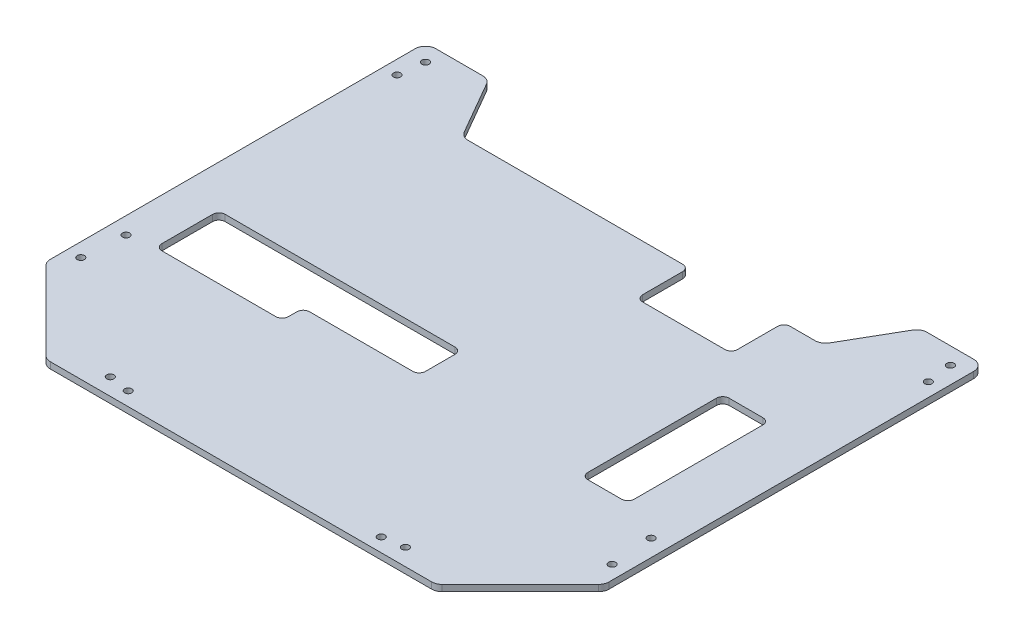
from build123d import *

# Parameters (mm, degrees)
BOSS_EXTRU_1_DEPTH      = 3
CONG_1_R                = 5
ESQUISSE2_R             = 1
ESQUISSE2_R_2           = 1.5
ENL_V_MAT_EXTRU_1_DEPTH = 257.837010573
D_GAGEMENT_M31_D        = 3.4
ESQUISSE5_W             = 45
ESQUISSE5_H             = 25
ESQUISSE5_W_2           = 22
ESQUISSE5_H_2           = 67
ENL_V_MAT_EXTRU_2_DEPTH = 257.837010573
CONG_2_R                = 3


with BuildPart() as part:
    # Esquisse1 → Boss.-Extru.1 (new body)
    with BuildSketch(Plane(origin=(0, 0, 0), x_dir=(1, 0, 0), z_dir=(0, 1, 0))):
        Polygon((-92.5, 0), (92.5, 0), (132.5, 40), (132.5, 220), (102.5, 220), (85.179491924, 190), (-85.179491924, 190), (-102.5, 220), (-132.5, 220), (-132.5, 40), align=None)
    extrude(amount=BOSS_EXTRU_1_DEPTH)

    # Congé1
    cong_1_edges = [part.edges().sort_by_distance(p)[0] for p in [
        (132.5, 1.5, -220),
        (102.5, 1.5, -220),
        (85.179491924, 1.5, -190),
        (-85.179491924, 1.5, -190),
        (-102.5, 1.5, -220),
        (-132.5, 1.5, -220),
        (-132.5, 1.5, -40),
        (-92.5, 1.5, 0),
        (92.5, 1.5, 0),
        (132.5, 1.5, -40),
    ]]
    fillet(cong_1_edges, radius=CONG_1_R)

    # Esquisse2 → Enlèv. mat.-Extru.1 (cut, through all)
    with BuildSketch(Plane.XZ):
        with Locations((-70, -8)):
            Circle(ESQUISSE2_R)
        with Locations((-124.5, -70)):
            Circle(ESQUISSE2_R)
        with Locations((-124.5, -212)):
            Circle(ESQUISSE2_R)
        with Locations((124.5, -212)):
            Circle(ESQUISSE2_R)
        with Locations((124.5, -70)):
            Circle(ESQUISSE2_R)
        with Locations((70, -8)):
            Circle(ESQUISSE2_R)
        with Locations((126, -50)):
            Circle(ESQUISSE2_R_2)
        with Locations((126, -200)):
            Circle(ESQUISSE2_R_2)
        with Locations((-60, -6.5)):
            Circle(ESQUISSE2_R_2)
        with Locations((60, -6.5)):
            Circle(ESQUISSE2_R_2)
        with Locations((-126, -50)):
            Circle(ESQUISSE2_R_2)
        with Locations((-126, -200)):
            Circle(ESQUISSE2_R_2)
    extrude(amount=-ENL_V_MAT_EXTRU_1_DEPTH, mode=Mode.SUBTRACT)

    # Dégagement M31 (through all)
    with Locations(Plane(origin=(0, 0, 0), x_dir=(-1, 0, 0), z_dir=(0, -1, 0))):
        with Locations((-70, 8), (-124.5, 70), (-124.5, 212), (124.5, 212), (124.5, 70), (70, 8), (-126, 200), (-126, 50), (-60, 6.5), (60, 6.5), (126, 50), (126, 200)):
            Hole(D_GAGEMENT_M31_D / 2)

    # Esquisse5 → Enlèv. mat.-Extru.2 (cut, through all)
    with BuildSketch(Plane.XZ):
        with Locations((45, -177.5)):
            Rectangle(ESQUISSE5_W, ESQUISSE5_H)
        Polygon((-112.5, -82), (-112.5, -72), (-52.5, -72), (-52.5, -82), (2.5, -82), (2.5, -102), (-112.5, -102), align=None)
        with Locations((93.5, -112.5)):
            Rectangle(ESQUISSE5_W_2, ESQUISSE5_H_2)
    extrude(amount=-ENL_V_MAT_EXTRU_2_DEPTH, mode=Mode.SUBTRACT)

    # Congé2
    cong_2_edges = [part.edges().sort_by_distance(p)[0] for p in [
        (67.5, 1.5, -190),
        (67.5, 1.5, -165),
        (22.5, 1.5, -165),
        (22.5, 1.5, -190),
        (104.5, 1.5, -146),
        (82.5, 1.5, -146),
        (82.5, 1.5, -79),
        (104.5, 1.5, -79),
        (2.5, 1.5, -82),
        (2.5, 1.5, -102),
        (-112.5, 1.5, -102),
        (-52.5, 1.5, -72),
        (-52.5, 1.5, -82),
        (-112.5, 1.5, -72),
    ]]
    fillet(cong_2_edges, radius=CONG_2_R)


solid = part.part
